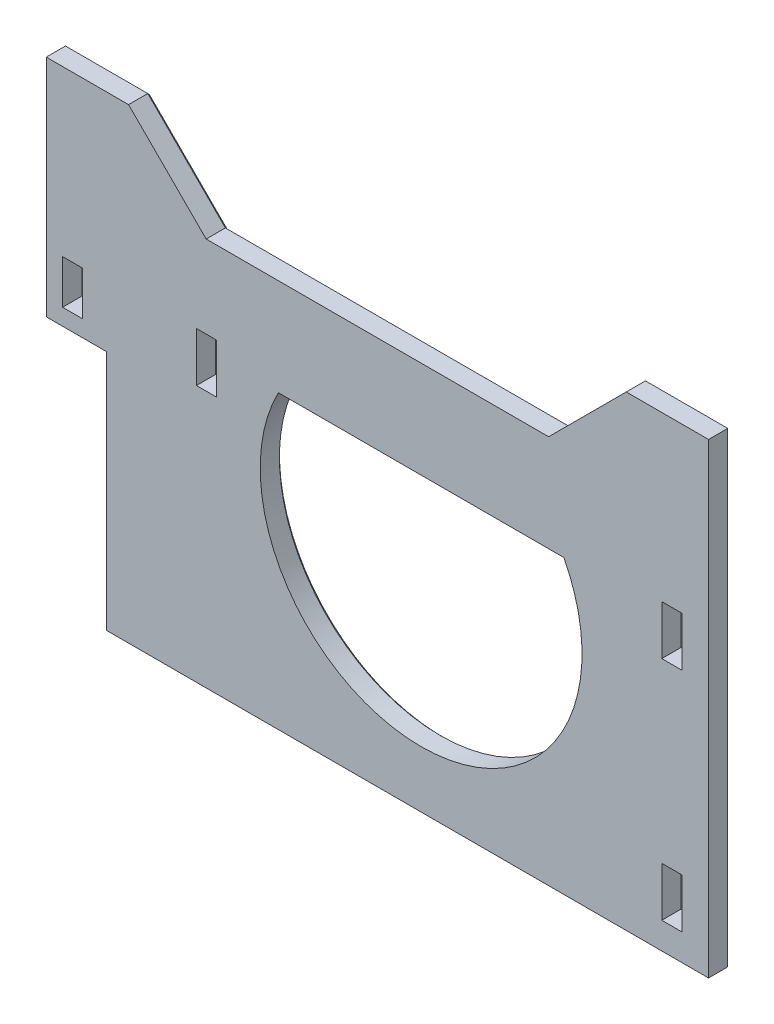
from build123d import *

# Parameters (mm, degrees)
SKETCH1_W           = 3.65
SKETCH1_H           = 9
SKETCH1_H_2         = 8
BOSS_EXTRUDE1_DEPTH = 4
BOSS_EXTRUDE2_DEPTH = 4
CHAMFER1_SIZE       = 0.5


with BuildPart() as part:
    # Sketch1 → Boss-Extrude1 (new body)
    with BuildSketch(Plane.XY):
        Polygon((52.5, 30), (52.5, -30), (-57.2, -30), (-57.2, 14), (-68.2, 14), (-68.2, 30), align=None)
        with BuildLine():
            Line((-25.900000003, 23.179137901), (26.135555553, 23.179137901))
            ThreePointArc((26.135555553, 23.179137901), (0.117777775, -19.676914391), (-25.900000003, 23.179137901))
        make_face(mode=Mode.SUBTRACT)
        with Locations((-39, 21.35)):
            Rectangle(SKETCH1_W, SKETCH1_H, mode=Mode.SUBTRACT)
        with Locations((45.8, 20.65)):
            Rectangle(SKETCH1_W, SKETCH1_H, mode=Mode.SUBTRACT)
        with Locations((45.8, -20.65)):
            Rectangle(SKETCH1_W, SKETCH1_H, mode=Mode.SUBTRACT)
        with Locations((-63.4, 21)):
            Rectangle(SKETCH1_W, SKETCH1_H_2, mode=Mode.SUBTRACT)
    extrude(amount=BOSS_EXTRUDE1_DEPTH)

    # Sketch2 → Boss-Extrude2 (add)
    with BuildSketch(Plane.XY):
        Polygon((-68.2, 30), (52.5, 30), (52.5, 55), (37.5, 55), (23.357864376, 40.857864376), (-39.057864376, 40.857864376), (-53.2, 55), (-68.2, 55), align=None)
    extrude(amount=BOSS_EXTRUDE2_DEPTH)

    # Chamfer1
    chamfer1_edges = [part.edges().sort_by_distance(p)[0] for p in [
        (45.8, -25.15, 0),
        (43.975, -20.65, 0),
        (45.8, -16.15, 0),
        (47.625, -20.65, 0),
        (-63.4, 25, 0),
        (-61.575, 21, 0),
        (-63.4, 17, 0),
        (-65.225, 21, 0),
        (0.117777775, 23.179137901, 0),
        (0.117777775, -19.676914391, 0),
        (-62.7, 14, 0),
        (-57.2, -8, 0),
        (-2.35, -30, 0),
        (52.5, 12.5, 0),
        (45, 55, 0),
        (30.428932188, 47.928932188, 0),
        (-7.85, 40.857864376, 0),
        (-46.128932188, 47.928932188, 0),
        (-60.7, 55, 0),
        (-68.2, 34.5, 0),
        (-39, 25.85, 0),
        (-37.175, 21.35, 0),
        (-39, 16.85, 0),
        (-40.825, 21.35, 0),
        (45.8, 25.15, 0),
        (47.625, 20.65, 0),
        (45.8, 16.15, 0),
        (43.975, 20.65, 0),
    ]]
    chamfer(chamfer1_edges, length=CHAMFER1_SIZE)


solid = part.part
